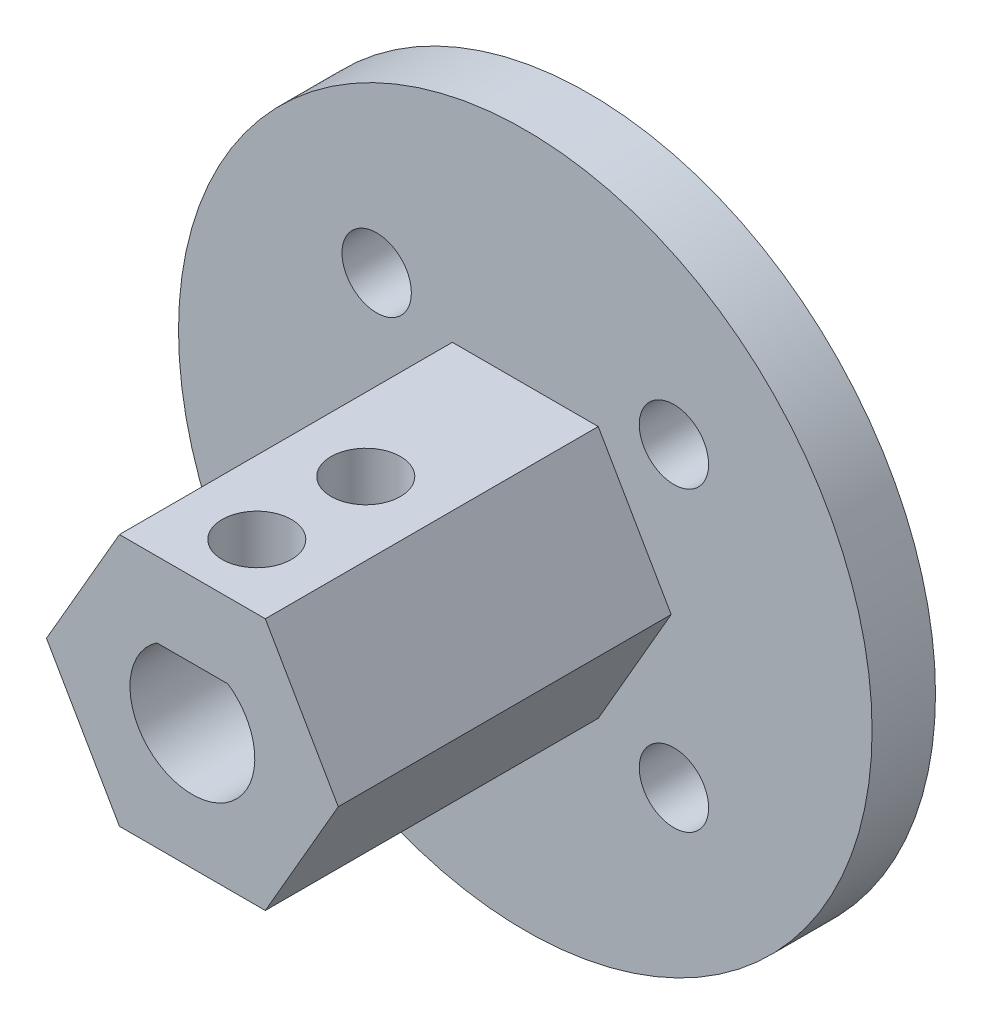
from build123d import *

# Parameters (mm, degrees)
SALIENTE_EXTRUIR1_DEPTH    = 20
CROQUIS2_R                 = 1.75
CORTAR_EXTRUIR1_DEPTH      = 7.5
CROQUIS3_R                 = 17.5
SALIENTE_EXTRUIR2_DEPTH    = 3.2
CORTAR_EXTRUIR2_DEPTH      = 32.819805153
CORTAR_EXTRUIR2_DEPTH_BACK = 5
CROQUIS5_R                 = 1.75


with BuildPart() as part:
    # Croquis1 → Saliente-Extruir1 (new body)
    with BuildSketch(Plane.XY):
        Polygon((7.361677812, 0), (3.680838906, 6.3754), (-3.680838906, 6.3754), (-7.361677812, 0), (-3.680838906, -6.3754), (3.680838906, -6.3754), align=None)
        with BuildLine():
            Line((-1.8, 2.585053191), (1.8, 2.585053191))
            ThreePointArc((1.8, 2.585053191), (0, -3.15), (-1.8, 2.585053191))
        make_face(mode=Mode.SUBTRACT)
    extrude(amount=SALIENTE_EXTRUIR1_DEPTH)

    # Croquis2 → Cortar-Extruir1 (cut)
    with BuildSketch(Plane(origin=(0, 6.3754, 0), x_dir=(1, 0, 0), z_dir=(0, 1, 0))):
        with Locations((0, -16.75)):
            Circle(CROQUIS2_R)
        with Locations((0, -11.25)):
            Circle(CROQUIS2_R)
    extrude(amount=-CORTAR_EXTRUIR1_DEPTH, mode=Mode.SUBTRACT)

    # Croquis3 → Saliente-Extruir2 (add)
    with BuildSketch(Plane(origin=(0, 0, 0), x_dir=(-1, 0, 0), z_dir=(0, 0, -1))):
        Circle(CROQUIS3_R)
    extrude(amount=-SALIENTE_EXTRUIR2_DEPTH)

    # Croquis5 → Cortar-Extruir2 (cut, two sides: drawn at the far end of the back side and taken through both)
    with BuildSketch(Plane(origin=(0, 0, 0), x_dir=(-1, 0, 0), z_dir=(0, 0, -1)).offset(-CORTAR_EXTRUIR2_DEPTH_BACK)):
        with Locations((-7.5, 7.5)):
            Circle(CROQUIS5_R)
        with Locations((7.5, 7.5)):
            Circle(CROQUIS5_R)
        with Locations((7.5, -7.5)):
            Circle(CROQUIS5_R)
        with Locations((-7.5, -7.5)):
            Circle(CROQUIS5_R)
    extrude(amount=CORTAR_EXTRUIR2_DEPTH + CORTAR_EXTRUIR2_DEPTH_BACK, mode=Mode.SUBTRACT)


solid = part.part
